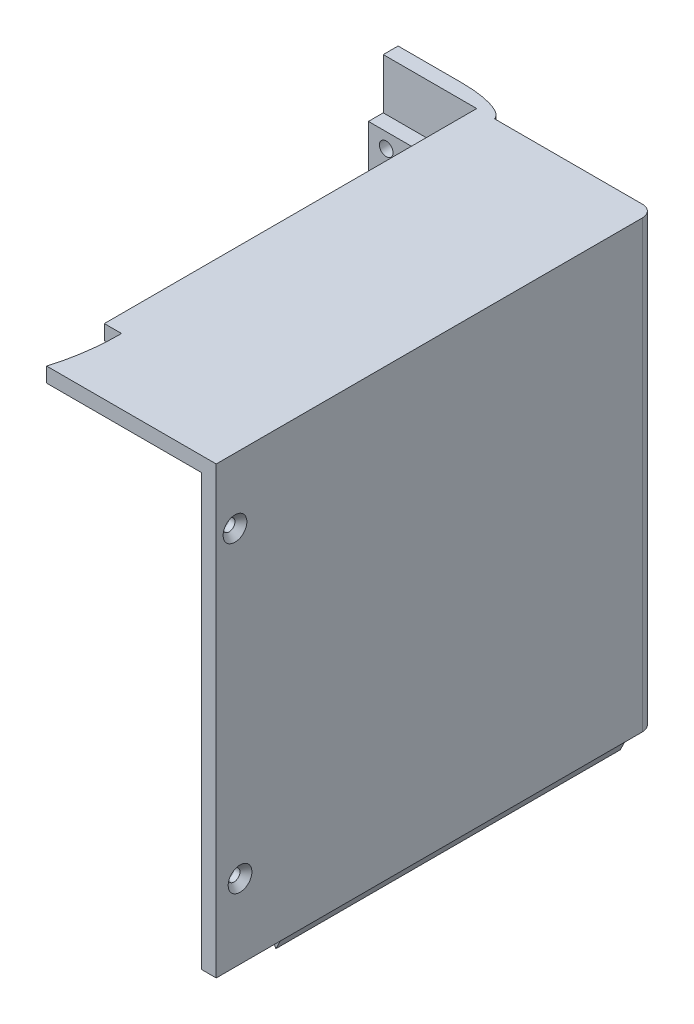
from build123d import *

# Parameters (mm, degrees)
BOSS_EXTRUDE1_DEPTH = 75
FILLET1_R           = 2
SKETCH4_R           = 1.15
CUT_EXTRUDE2_DEPTH  = 5
BOSS_EXTRUDE2_DEPTH = 58
SKETCH7_W           = 12
SKETCH7_H           = 80
CUT_EXTRUDE3_DEPTH  = 5
SKETCH8_W           = 2.5
SKETCH8_H           = 75
BOSS_EXTRUDE3_DEPTH = 20
SKETCH10_W          = 71.647703853
SKETCH10_H          = 2.5
BOSS_EXTRUDE4_DEPTH = 20
SKETCH12_W          = 3.098039447
SKETCH12_H          = 2.1077236
CUT_EXTRUDE4_DEPTH  = 58
SKETCH13_W          = 11.16
SKETCH13_H          = 75
BOSS_EXTRUDE6_DEPTH = 2
SKETCH14_R          = 1
SKETCH14_R_2        = 0.99762978
CUT_EXTRUDE5_DEPTH  = 10
CHAMFER2_SIZE       = 1
SKETCH16_W          = 2.5
SKETCH16_H          = 75
BOSS_EXTRUDE7_DEPTH = 10
SKETCH17_W          = 71.3
SKETCH17_H          = 2.5
BOSS_EXTRUDE8_DEPTH = 10
SKETCH18_R          = 1.15
CUT_EXTRUDE7_DEPTH  = 4
CUT_EXTRUDE8_DEPTH  = 10
BOSS_EXTRUDE9_START = 2.5
SKETCH21_W          = 18.75
SKETCH21_H          = 75
SKETCH21_R          = 1.15
BOSS_EXTRUDE9_DEPTH = 2.5
CUT_EXTRUDE10_DEPTH = 2.5
CHAMFER3_SIZE       = 1
FILLET2_START       = -1
FILLET2_DEPTH       = 77


with BuildPart() as part:
    # Sketch1 → Boss-Extrude1 (new body)
    with BuildSketch(Plane(origin=(0, 0, 0), x_dir=(1, 0, 0), z_dir=(0, 1, 0))):
        with BuildLine():
            Line((-23.765673143, -52.966666667), (-21.11640892, -52.966666667))
            ThreePointArc((-21.11640892, -52.966666667), (-19.749251579, -47.460938782), (-19.289506454, -41.806666667))
            Line((-19.289506454, -41.806666667), (-19.289506454, 18.333333333))
            Line((-19.289506454, 18.333333333), (-19.289506454, 20.833333333))
            Line((-19.289506454, 20.833333333), (-34.949506454, 20.833333333))
            Line((-34.949506454, 20.833333333), (-34.949506454, 18.333333333))
            Line((-34.949506454, 18.333333333), (-21.789506454, 18.333333333))
            Line((-21.789506454, 18.333333333), (-21.789506454, -41.806666667))
            ThreePointArc((-21.789506454, -41.806666667), (-22.287361349, -47.473474295), (-23.765673143, -52.966666667))
        make_face()
    extrude(amount=BOSS_EXTRUDE1_DEPTH)

    # Fillet1
    fillet1_edges = [part.edges().sort_by_distance(p)[0] for p in [
        (-21.789506454, 37.5, -18.333333333),
        (-19.289506454, 37.5, -20.833333333),
    ]]
    fillet(fillet1_edges, radius=FILLET1_R)

    # Sketch4 → Cut-Extrude2 (cut)
    with BuildSketch(Plane(origin=(-19.289506454, 0, 0), x_dir=(0, 0, -1), z_dir=(1, 0, 0))):
        with Locations((-49.806666667, 64)):
            Circle(SKETCH4_R)
        with Locations((-48.955669454, 12.5)):
            Circle(SKETCH4_R)
    extrude(amount=-CUT_EXTRUDE2_DEPTH, mode=Mode.SUBTRACT)

    # Sketch6 → Boss-Extrude2 (add)
    with BuildSketch(Plane(origin=(0, 0, -16.333333333), x_dir=(-1, 0, 0), z_dir=(0, 0, -1))):
        Polygon((19.539506454, 75), (21.539506454, 75), (20.48442105, 77), align=None)
        Polygon((21.539506454, 0), (19.539506454, 0), (20.539506454, -2), align=None)
    extrude(amount=-BOSS_EXTRUDE2_DEPTH)

    # Sketch7 → Cut-Extrude3 (cut)
    with BuildSketch(Plane.ZY.offset(21.789506454)):
        with Locations((47.806666667, 35)):
            Rectangle(SKETCH7_W, SKETCH7_H)
    extrude(amount=CUT_EXTRUDE3_DEPTH, mode=Mode.SUBTRACT)

    # Sketch8 → Boss-Extrude3 (add)
    with BuildSketch(Plane.ZY.offset(34.949506454)):
        with Locations((-19.583333333, 37.5)):
            Rectangle(SKETCH8_W, SKETCH8_H)
    extrude(amount=BOSS_EXTRUDE3_DEPTH)

    # Sketch10 → Boss-Extrude4 (add)
    with BuildSketch(Plane.ZY.offset(21.789506454)):
        with Locations((17.142814741, 73.75)):
            Rectangle(SKETCH10_W, SKETCH10_H)
    extrude(amount=BOSS_EXTRUDE4_DEPTH)

    # Sketch12 → Cut-Extrude4 (cut)
    with BuildSketch(Plane(origin=(0, 0, -16.333333333), x_dir=(-1, 0, 0), z_dir=(0, 0, -1))):
        with Locations((20.374958132, 76.0538618)):
            Rectangle(SKETCH12_W, SKETCH12_H)
    extrude(amount=-CUT_EXTRUDE4_DEPTH, mode=Mode.SUBTRACT)

    # Sketch13 → Boss-Extrude6 (add)
    with BuildSketch(Plane(origin=(-19.289506454, 0, 0), x_dir=(0, 0, -1), z_dir=(1, 0, 0))):
        with Locations((-47.386666667, 37.5)):
            Rectangle(SKETCH13_W, SKETCH13_H)
    extrude(amount=-BOSS_EXTRUDE6_DEPTH)

    # Sketch14 → Cut-Extrude5 (cut)
    with BuildSketch(Plane.ZY.offset(21.289506454)):
        with Locations((49.806666667, 64)):
            Circle(SKETCH14_R)
        with Locations((48.955669454, 12.5)):
            Circle(SKETCH14_R_2)
    extrude(amount=-CUT_EXTRUDE5_DEPTH, mode=Mode.SUBTRACT)

    # Chamfer2
    chamfer2_edges = [part.edges().sort_by_distance(p)[0] for p in [
        (-19.289506454, 64, 48.806666667),
        (-19.289506454, 12.5, 47.958039674),
    ]]
    chamfer(chamfer2_edges, length=CHAMFER2_SIZE)

    # Sketch16 → Boss-Extrude7 (add)
    with BuildSketch(Plane.ZY.offset(54.949506454)):
        with Locations((-19.583333333, 37.5)):
            Rectangle(SKETCH16_W, SKETCH16_H)
    extrude(amount=BOSS_EXTRUDE7_DEPTH)

    # Sketch17 → Boss-Extrude8 (add)
    with BuildSketch(Plane.ZY.offset(41.789506454)):
        with Locations((17.316666667, 73.75)):
            Rectangle(SKETCH17_W, SKETCH17_H)
    extrude(amount=BOSS_EXTRUDE8_DEPTH)

    # Sketch18 → Cut-Extrude7 (cut)
    with BuildSketch(Plane(origin=(0, 0, -20.833333333), x_dir=(-1, 0, 0), z_dir=(0, 0, -1))):
        with Locations((61.949506454, 64)):
            Circle(SKETCH18_R)
        with Locations((61.949506454, 37.5)):
            Circle(SKETCH18_R)
        with Locations((61.949506454, 11)):
            Circle(SKETCH18_R)
    extrude(amount=-CUT_EXTRUDE7_DEPTH, mode=Mode.SUBTRACT)

    # Sketch20 → Cut-Extrude8 (cut)
    with BuildSketch(Plane(origin=(0, 75, 0), x_dir=(1, 0, 0), z_dir=(0, 1, 0))):
        with BuildLine():
            Line((-46.299506454, -41.906666667), (-49.199506454, -41.906666667))
            Line((-49.199506454, -41.906666667), (-49.199506454, 18.333333333))
            Line((-49.199506454, 18.333333333), (-51.789506454, 18.333333333))
            Line((-51.789506454, 18.333333333), (-51.789506454, -52.966666667))
            Line((-51.789506454, -52.966666667), (-47.849506454, -52.966666667))
            ThreePointArc((-47.849506454, -52.966666667), (-46.665976454, -47.493919967), (-46.299506454, -41.906666667))
        make_face()
    extrude(amount=-CUT_EXTRUDE8_DEPTH, mode=Mode.SUBTRACT)

    # Sketch21 → Boss-Extrude9 (add)
    with BuildSketch(Plane(origin=(0, 0, -20.833333333), x_dir=(-1, 0, 0), z_dir=(0, 0, -1)).offset(BOSS_EXTRUDE9_START)):
        with Locations((55.574506454, 37.5)):
            Rectangle(SKETCH21_W, SKETCH21_H)
        with Locations((61.949506454, 11)):
            Circle(SKETCH21_R, mode=Mode.SUBTRACT)
        with Locations((61.949506454, 37.5)):
            Circle(SKETCH21_R, mode=Mode.SUBTRACT)
        with Locations((61.949506454, 64)):
            Circle(SKETCH21_R, mode=Mode.SUBTRACT)
    extrude(amount=-BOSS_EXTRUDE9_DEPTH)

    # Sketch22 → Cut-Extrude10 (cut)
    with BuildSketch(Plane.XY.offset(-18.333333333)):
        Polygon((-49.199506454, 66.5), (-49.199506454, 72.5), (-49.199506454, 75), (-64.949506454, 75), (-64.949506454, 66.5), align=None)
    extrude(amount=-CUT_EXTRUDE10_DEPTH, mode=Mode.SUBTRACT)

    # Chamfer3
    chamfer3_edges = [part.edges().sort_by_distance(p)[0] for p in [
        (-60.799506454, 37.5, -23.333333333),
        (-60.799506454, 11, -23.333333333),
        (-60.799506454, 64, -23.333333333),
    ]]
    chamfer(chamfer3_edges, length=CHAMFER3_SIZE)

    # Fillet2: read off the stored shape, not the designer's step
    # Fillet2 outline → Fillet2 (cut)
    with BuildSketch(Plane(origin=(0, 0, 0), x_dir=(1, 0, 0), z_dir=(0, 1, 0)).offset(FILLET2_START)):
        with BuildLine():
            add(Edge.make_bspline(
                [(-46.199506454, 20.833333333), (-46.968828273, 23.333333333), (-54.323544859, 23.333333333)],
                knots=[0, 0, 0, 1, 1, 1], degree=2, weights=[1, 0.804399667, 1]))
            Line((-46.199506454, 20.833333333), (-46.199506454, 23.333333333))
            Line((-46.199506454, 23.333333333), (-54.323544859, 23.333333333))
        make_face()
    extrude(amount=FILLET2_DEPTH, mode=Mode.SUBTRACT)


solid = part.part
